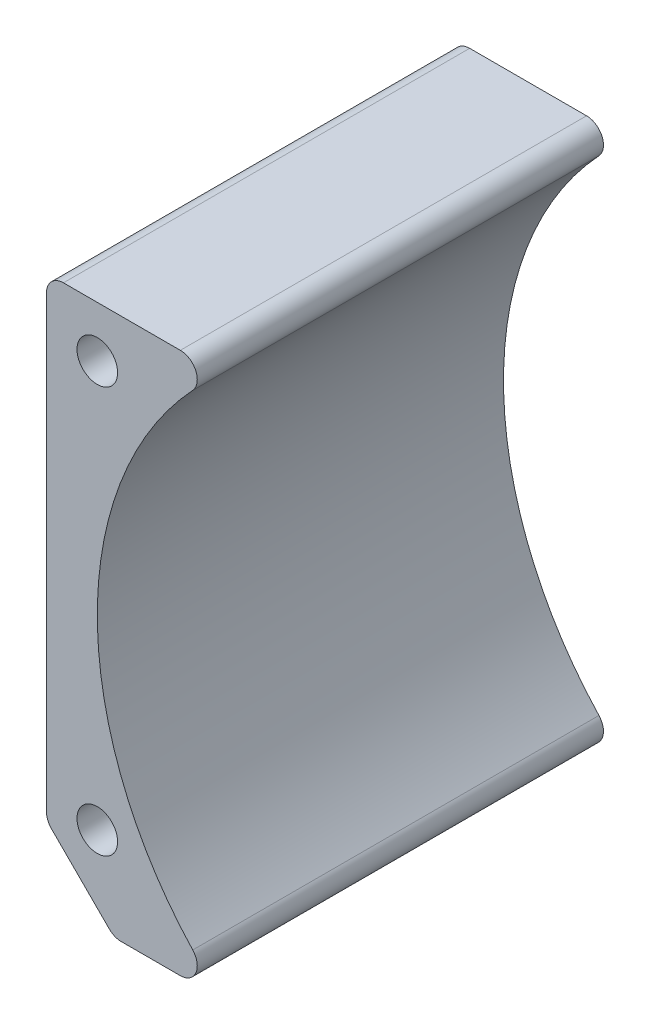
from build123d import *

# Parameters (mm, degrees)
BOSS_EXTRUDE1_DEPTH = 38.1
SKETCH2_R           = 1.905
CUT_EXTRUDE1_DEPTH  = 66.61061669
CHAMFER1_SIZE       = 6.35
FILLET1_R           = 1.5875


with BuildPart() as part:
    # Sketch1 → Boss-Extrude1 (new body)
    with BuildSketch(Plane.XY):
        with BuildLine():
            Line((0, 0), (16.507665567, 0))
            ThreePointArc((16.507665567, 0), (4.7625, 25.4), (16.507665567, 50.8))
            Line((16.507665567, 50.8), (0, 50.8))
            Line((0, 50.8), (0, 0))
        make_face()
    extrude(amount=BOSS_EXTRUDE1_DEPTH)

    # Sketch2 → Cut-Extrude1 (cut, through all)
    with BuildSketch(Plane.XY.offset(38.1)):
        with Locations((4.7625, 46.0375)):
            Circle(SKETCH2_R)
        with Locations((4.7625, 7.9375)):
            Circle(SKETCH2_R)
    extrude(amount=-CUT_EXTRUDE1_DEPTH, mode=Mode.SUBTRACT)

    # Chamfer1
    chamfer1_edges = [part.edges().sort_by_distance(p)[0] for p in [
        (0, 0, 19.05),
    ]]
    chamfer(chamfer1_edges, length=CHAMFER1_SIZE)

    # Fillet1
    fillet1_edges = [part.edges().sort_by_distance(p)[0] for p in [
        (0, 6.35, 19.05),
        (6.35, 0, 19.05),
        (16.507665567, 0, 19.05),
        (16.507665567, 50.8, 19.05),
        (0, 50.8, 19.05),
    ]]
    fillet(fillet1_edges, radius=FILLET1_R)


solid = part.part
